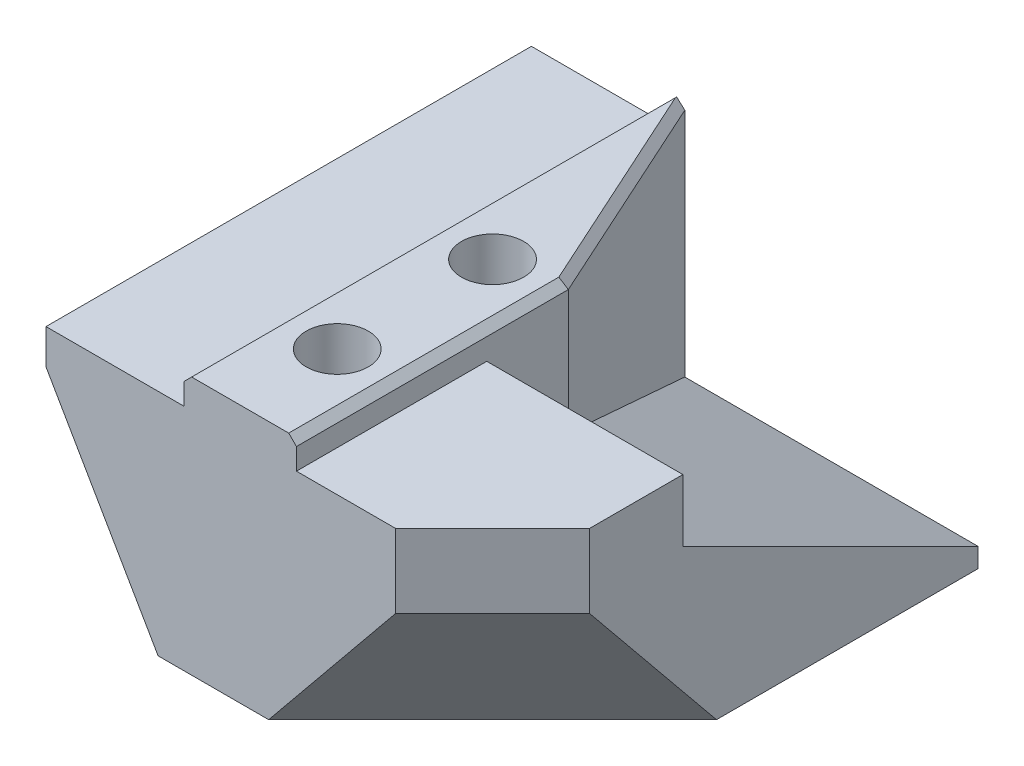
from build123d import *

# Parameters (mm, degrees)
SKETCH_1_W           = 20
SKETCH_1_H           = 20
EXTRUDE_1_DEPTH      = 4
SKETCH_2_W           = 12.9
SKETCH_2_H           = 20
EXTRUDE_2_DEPTH      = 3.8
SKETCH_3_R           = 1.6
CUT_EXTRUDE_1_DEPTH  = 30.340074983
SKETCH_4_W           = 5.8
SKETCH_4_H           = 20
SKETCH_4_R           = 1.6
EXTRUDE_3_DEPTH      = 1.5
SKETCH_5_R           = 3
CUT_EXTRUDE_3_DEPTH  = 2.4
SKETCH_6_W           = 20
SKETCH_6_H           = 4
EXTRUDE_4_DEPTH      = 3
EXTRUDE_START        = 4
SKETCH_7_W           = 23
SKETCH_7_H           = 20
SKETCH_7_R           = 3
EXTRUDE_5_DEPTH      = 4
SKETCH_9_W           = 10.1
SKETCH_9_H           = 20
EXTRUDE_6_DEPTH      = 2
EXTRUDE_7_DEPTH      = 5
CHAMFER_7_SIZE       = 10
CHAMFER_7_SIZE2      = 5.773502692
CHAMFER_8_SIZE       = 5
CHAMFER_9_SIZE       = 8
CHAMFER_9_SIZE2      = 4.618802154
CUT_EXTRUDE_9_DEPTH  = 10.1
CUT_EXTRUDE_10_REACH = 38.481
CHAMFER_10_SIZE      = 1.5
CHAMFER_11_SIZE      = 0.4
EXTRUDE_8_DEPTH      = 1.8
EXTRUDE_10_DEPTH     = 10.1


with BuildPart() as part:
    # 草图1 → 凸台-拉伸1 (new body)
    with BuildSketch(Plane(origin=(0, 0, 0), x_dir=(1, 0, 0), z_dir=(0, 1, 0))):
        with Locations((10, 10)):
            Rectangle(SKETCH_1_W, SKETCH_1_H)
    extrude(amount=EXTRUDE_1_DEPTH)

    # 草图2 → 凸台-拉伸2 (add)
    with BuildSketch(Plane(origin=(0, 4, 0), x_dir=(1, 0, 0), z_dir=(0, 1, 0))):
        with Locations((6.45, 10)):
            Rectangle(SKETCH_2_W, SKETCH_2_H)
    extrude(amount=EXTRUDE_2_DEPTH)

    # 草图3 → 切除-拉伸1 (cut, through all)
    with BuildSketch(Plane(origin=(0, 0, 0), x_dir=(-1, 0, 0), z_dir=(0, -1, 0))):
        with Locations(Location((-10, 5, 0), (0, 0, 90))):
            Circle(SKETCH_3_R)
        with Locations(Location((-10, 13, 0), (0, 0, 90))):
            Circle(SKETCH_3_R)
    extrude(amount=-CUT_EXTRUDE_1_DEPTH, mode=Mode.SUBTRACT)

    # 草图4 → 凸台-拉伸3 (add)
    with BuildSketch(Plane(origin=(0, 7.8, 0), x_dir=(1, 0, 0), z_dir=(0, 1, 0))):
        with Locations((10, 10)):
            Rectangle(SKETCH_4_W, SKETCH_4_H)
        with Locations(Location((10, 13, 0), (0, 0, 90))):
            Circle(SKETCH_4_R, mode=Mode.SUBTRACT)
        with Locations(Location((10, 5, 0), (0, 0, 90))):
            Circle(SKETCH_4_R, mode=Mode.SUBTRACT)
    extrude(amount=EXTRUDE_3_DEPTH)

    # 草图5 → 切除-拉伸3 (cut)
    with BuildSketch(Plane(origin=(0, 0, 0), x_dir=(-1, 0, 0), z_dir=(0, -1, 0))):
        with Locations(Location((-10, 5, 0), (0, 0, 90))):
            Circle(SKETCH_5_R)
        with Locations(Location((-10, 13, 0), (0, 0, 90))):
            Circle(SKETCH_5_R)
    extrude(amount=-CUT_EXTRUDE_3_DEPTH, mode=Mode.SUBTRACT)

    # 草图6 → 凸台-拉伸4 (add)
    with BuildSketch(Plane(origin=(20, 0, 0), x_dir=(0, 0, -1), z_dir=(1, 0, 0))):
        with Locations((10, 2)):
            Rectangle(SKETCH_6_W, SKETCH_6_H)
    extrude(amount=EXTRUDE_4_DEPTH)

    # 草图7 → 凸台-拉伸5 (add)
    with BuildSketch(Plane(origin=(0, 0, 0), x_dir=(-1, 0, 0), z_dir=(0, -1, 0)).offset(EXTRUDE_START)):
        with Locations((-11.5, 10)):
            Rectangle(SKETCH_7_W, SKETCH_7_H)
        with Locations(Location((-10, 13, 0), (0, 0, 90))):
            Circle(SKETCH_7_R, mode=Mode.SUBTRACT)
        with Locations(Location((-10, 5, 0), (0, 0, 90))):
            Circle(SKETCH_7_R, mode=Mode.SUBTRACT)
    extrude(amount=-EXTRUDE_5_DEPTH)

    # 草图9 → 凸台-拉伸6 (add)
    with BuildSketch(Plane(origin=(0, 4, 0), x_dir=(1, 0, 0), z_dir=(0, 1, 0))):
        with Locations((17.95, 10)):
            Rectangle(SKETCH_9_W, SKETCH_9_H)
    extrude(amount=EXTRUDE_6_DEPTH)

    # 草图11 → 凸台-拉伸7 (add)
    with BuildSketch(Plane(origin=(0, 0, -20), x_dir=(-1, 0, 0), z_dir=(0, 0, -1))):
        Polygon((-23, 6), (-23, -4), (0, -4), (0, 7.8), (-7.1, 7.8), (-7.1, 9.3), (-12.9, 9.3), (-12.9, 6), align=None)
    extrude(amount=EXTRUDE_7_DEPTH)

    # 倒角7
    chamfer_7_edges = [part.edges().sort_by_distance(p)[0] for p in [
        (0, -4, -12.5),
    ]]
    chamfer_7_side = [part.faces().sort_by_distance(p)[0] for p in [
        (0, 1.9, -12.5),
    ]]
    chamfer(chamfer_7_edges, length=CHAMFER_7_SIZE, length2=CHAMFER_7_SIZE2, reference=chamfer_7_side[0])

    # 倒角8
    chamfer_8_edges = [part.edges().sort_by_distance(p)[0] for p in [
        (23, 1, 0),
    ]]
    chamfer(chamfer_8_edges, length=CHAMFER_8_SIZE)

    # 倒角9
    chamfer_9_edges = [part.edges().sort_by_distance(p)[0] for p in [
        (20.5, -4, -2.5),
    ]]
    chamfer_9_side = [part.faces().sort_by_distance(p)[0] for p in [
        (20.5, 1, -2.5),
    ]]
    chamfer(chamfer_9_edges, length=CHAMFER_9_SIZE, length2=CHAMFER_9_SIZE2, reference=chamfer_9_side[0])

    # 草图15 → 切除-拉伸9 (cut)
    with BuildSketch(Plane(origin=(23, 0, 0), x_dir=(0, 0, -1), z_dir=(1, 0, 0))):
        Polygon((25, -3), (25, 6), (7, 6), align=None)
    extrude(amount=-CUT_EXTRUDE_9_DEPTH, mode=Mode.SUBTRACT)

    # 切除-拉伸10: up to this plane
    cut_extrude_10_end = Plane(origin=(-7.224611797, 6, -7), z_dir=(0, -0.894427190999916, 0.447213595499958))
    # 草图16 → 切除-拉伸10 (cut, up to the surface)
    with BuildSketch(Plane(origin=(0, 9.3, 0), x_dir=(1, 0, 0), z_dir=(0, 1, 0)), mode=Mode.PRIVATE) as cut_extrude_10_sk1:
        Polygon((7.9, 25), (12.9, 25), (12.9, 14), align=None)
    cut_extrude_10_tool1 = split(extrude(cut_extrude_10_sk1.sketch, amount=-CUT_EXTRUDE_10_REACH, mode=Mode.PRIVATE), bisect_by=cut_extrude_10_end, keep=Keep.BOTH, mode=Mode.PRIVATE)
    add(cut_extrude_10_tool1.solids().sort_by_distance((11.233333, 9.3, -21.333333))[0], mode=Mode.SUBTRACT)

    # 倒角10
    # the kernel refuses this chamfer: 1.5 mm, written as the material it takes off along each edge
    with BuildSketch(Plane(origin=(10, 2.4, -13), x_dir=(0, 0, -1), z_dir=(-1, 0, 0))) as chamfer_10_piece_1_section:
        Polygon((1.6, -CHAMFER_10_SIZE), (1.6 + CHAMFER_10_SIZE, 0), (1.6, 0), align=None)
    chamfer_10_piece_1 = revolve(axis=Axis((10, 2.4, -13), (0, -1, 0)), mode=Mode.PRIVATE)
    chamfer_10_piece_1 = chamfer_10_piece_1 & Plane(origin=(10, 3.20338318, -13), x_dir=(0, 0, -1), z_dir=(0, -1, 0)) * Cylinder(3, 13, mode=Mode.PRIVATE)
    add(chamfer_10_piece_1, mode=Mode.SUBTRACT)
    with BuildSketch(Plane(origin=(10, 2.4, -5), x_dir=(0, 0, -1), z_dir=(-1, 0, 0))) as chamfer_10_piece_2_section:
        Polygon((1.6, -CHAMFER_10_SIZE), (1.6 + CHAMFER_10_SIZE, 0), (1.6, 0), align=None)
    chamfer_10_piece_2 = revolve(axis=Axis((10, 2.4, -5), (0, -1, 0)), mode=Mode.PRIVATE)
    chamfer_10_piece_2 = chamfer_10_piece_2 & Plane(origin=(10, 3.20338318, -5), x_dir=(0, 0, -1), z_dir=(0, -1, 0)) * Cylinder(3, 13, mode=Mode.PRIVATE)
    add(chamfer_10_piece_2, mode=Mode.SUBTRACT)

    # 倒角11
    # the kernel refuses this chamfer: 0.4 mm, written as the material it takes off along each edge
    with BuildSketch(Plane(origin=(13.325667997, 9.3, -13.063530407), x_dir=(-0.9100222832929536, 0.027495876610587288, 0.4136464924058883), z_dir=(-0.4138029443011842, 0, -0.9103664774626047))) as chamfer_11_piece_1:
        Polygon((CHAMFER_11_SIZE * 0.999621916911, -CHAMFER_11_SIZE * 0.0274958766106), (-CHAMFER_11_SIZE * 0.0274958766106, -CHAMFER_11_SIZE * 0.999621916911), (0, 0), align=None)
    extrude(amount=14.140392364, mode=Mode.SUBTRACT)
    with BuildSketch(Plane(origin=(12.9, 9.3, 1.028673195), x_dir=(-0.9996219169112966, 0.027495876610587302, 0), z_dir=(0, 0, -1))) as chamfer_11_piece_2:
        Polygon((CHAMFER_11_SIZE * 0.999621916911, -CHAMFER_11_SIZE * 0.0274958766106), (-CHAMFER_11_SIZE * 0.0274958766106, -CHAMFER_11_SIZE * 0.999621916911), (0, 0), align=None)
    extrude(amount=16.05734639, mode=Mode.SUBTRACT)
    with BuildSketch(Plane(origin=(7.1, 9.3, 1.028673195), x_dir=(0.9996219169112966, 0.027495876610587302, 0), z_dir=(0, 0, -1))) as chamfer_11_piece_3:
        Polygon((CHAMFER_11_SIZE * 0.999621916911, CHAMFER_11_SIZE * 0.0274958766106), (-CHAMFER_11_SIZE * 0.0274958766106, CHAMFER_11_SIZE * 0.999621916911), (0, 0), align=None)
    extrude(amount=27.05734639, mode=Mode.SUBTRACT)

    # 草图17 → 凸台-拉伸8 (add)
    with BuildSketch(Plane(origin=(0, 6, 0), x_dir=(1, 0, 0), z_dir=(0, 1, 0))):
        Polygon((23, 5), (23, 7), (12.9, 7), (12.9, 0), (18, 0), align=None)
    extrude(amount=EXTRUDE_8_DEPTH)

    # 草图19 → 凸台-拉伸10 (add)
    with BuildSketch(Plane(origin=(23, 0, 0), x_dir=(0, 0, -1), z_dir=(1, 0, 0))):
        Polygon((9.8, 7.8), (7, 7.8), (7, 6), (9.8, 4.6), align=None)
    extrude(amount=-EXTRUDE_10_DEPTH)


solid = part.part
